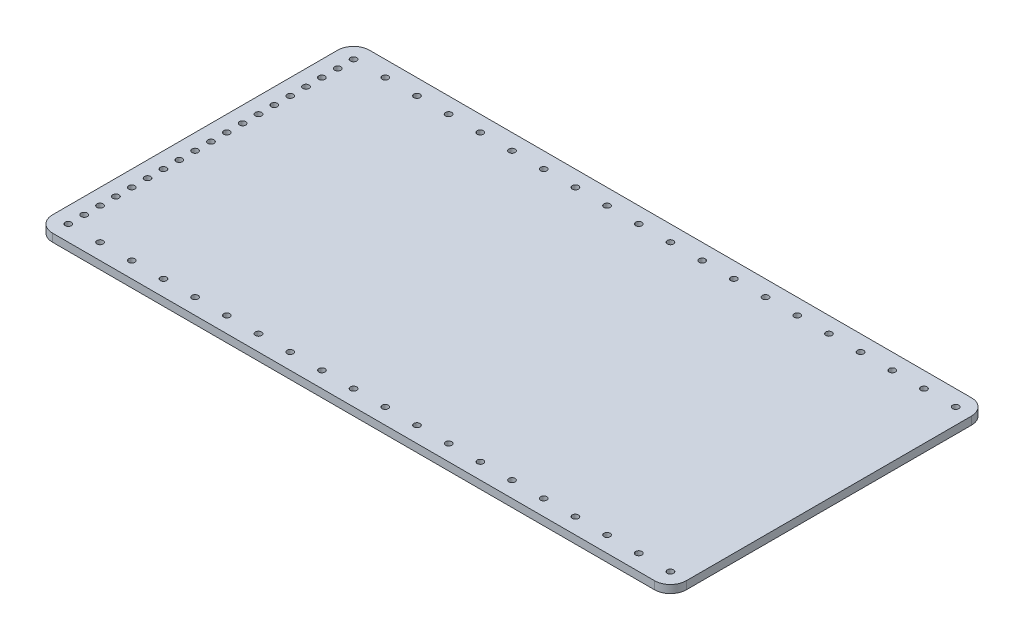
from build123d import *

# Parameters (mm, degrees)
SKETCH1_W           = 508
SKETCH1_H           = 254
BOSS_EXTRUDE1_DEPTH = 6.35
FILLET1_R           = 12.7
SKETCH3_R           = 2.4892
CUT_EXTRUDE2_DEPTH  = 568.996762755


with BuildPart() as part:
    # Sketch1 → Boss-Extrude1 (new body)
    with BuildSketch(Plane(origin=(0, 0, 0), x_dir=(1, 0, 0), z_dir=(0, 1, 0))):
        with Locations((254, 127)):
            Rectangle(SKETCH1_W, SKETCH1_H)
    extrude(amount=BOSS_EXTRUDE1_DEPTH)

    # Fillet1
    fillet1_edges = [part.edges().sort_by_distance(p)[0] for p in [
        (508, 3.175, -254),
        (508, 3.175, 0),
        (0, 3.175, 0),
        (0, 3.175, -254),
    ]]
    fillet(fillet1_edges, radius=FILLET1_R)

    # Sketch3 → Cut-Extrude2 (cut, through all)
    with BuildSketch(Plane(origin=(0, 6.35, 0), x_dir=(1, 0, 0), z_dir=(0, 1, 0))):
        with Locations((12.7, 203.2)):
            Circle(SKETCH3_R)
        with Locations((12.7, 215.9)):
            Circle(SKETCH3_R)
        with Locations((12.7, 228.6)):
            Circle(SKETCH3_R)
        with Locations((12.7, 241.3)):
            Circle(SKETCH3_R)
        with Locations((38.1, 241.3)):
            Circle(SKETCH3_R)
        with Locations((63.5, 241.3)):
            Circle(SKETCH3_R)
        with Locations((88.9, 241.3)):
            Circle(SKETCH3_R)
        with Locations((114.3, 241.3)):
            Circle(SKETCH3_R)
        with Locations((12.7, 12.7)):
            Circle(SKETCH3_R)
        with Locations((12.7, 25.4)):
            Circle(SKETCH3_R)
        with Locations((12.7, 38.1)):
            Circle(SKETCH3_R)
        with Locations((12.7, 50.8)):
            Circle(SKETCH3_R)
        with Locations((12.7, 63.5)):
            Circle(SKETCH3_R)
        with Locations((38.1, 12.7)):
            Circle(SKETCH3_R)
        with Locations((63.5, 12.7)):
            Circle(SKETCH3_R)
        with Locations((88.9, 12.7)):
            Circle(SKETCH3_R)
        with Locations((12.7, 101.6)):
            Circle(SKETCH3_R)
        with Locations((12.7, 114.3)):
            Circle(SKETCH3_R)
        with Locations((12.7, 127)):
            Circle(SKETCH3_R)
        with Locations((12.7, 139.7)):
            Circle(SKETCH3_R)
        with Locations((12.7, 165.1)):
            Circle(SKETCH3_R)
        with Locations((12.7, 152.4)):
            Circle(SKETCH3_R)
        with Locations((12.7, 177.8)):
            Circle(SKETCH3_R)
        with Locations((12.7, 190.5)):
            Circle(SKETCH3_R)
        with Locations((12.7, 88.9)):
            Circle(SKETCH3_R)
        with Locations((12.7, 76.2)):
            Circle(SKETCH3_R)
        with Locations((495.3, 12.7)):
            Circle(SKETCH3_R)
        with Locations((469.9, 12.7)):
            Circle(SKETCH3_R)
        with Locations((444.5, 12.7)):
            Circle(SKETCH3_R)
        with Locations((419.1, 12.7)):
            Circle(SKETCH3_R)
        with Locations((393.7, 12.7)):
            Circle(SKETCH3_R)
        with Locations((368.3, 12.7)):
            Circle(SKETCH3_R)
        with Locations((342.9, 12.7)):
            Circle(SKETCH3_R)
        with Locations((317.5, 12.7)):
            Circle(SKETCH3_R)
        with Locations((292.1, 12.7)):
            Circle(SKETCH3_R)
        with Locations((266.7, 12.7)):
            Circle(SKETCH3_R)
        with Locations((241.3, 12.7)):
            Circle(SKETCH3_R)
        with Locations((215.9, 12.7)):
            Circle(SKETCH3_R)
        with Locations((114.3, 12.7)):
            Circle(SKETCH3_R)
        with Locations((139.7, 12.7)):
            Circle(SKETCH3_R)
        with Locations((165.1, 12.7)):
            Circle(SKETCH3_R)
        with Locations((190.5, 12.7)):
            Circle(SKETCH3_R)
        with Locations((139.7, 241.3)):
            Circle(SKETCH3_R)
        with Locations((165.1, 241.3)):
            Circle(SKETCH3_R)
        with Locations((190.5, 241.3)):
            Circle(SKETCH3_R)
        with Locations((215.9, 241.3)):
            Circle(SKETCH3_R)
        with Locations((241.3, 241.3)):
            Circle(SKETCH3_R)
        with Locations((266.7, 241.3)):
            Circle(SKETCH3_R)
        with Locations((292.1, 241.3)):
            Circle(SKETCH3_R)
        with Locations((317.5, 241.3)):
            Circle(SKETCH3_R)
        with Locations((342.9, 241.3)):
            Circle(SKETCH3_R)
        with Locations((368.3, 241.3)):
            Circle(SKETCH3_R)
        with Locations((393.7, 241.3)):
            Circle(SKETCH3_R)
        with Locations((419.1, 241.3)):
            Circle(SKETCH3_R)
        with Locations((444.5, 241.3)):
            Circle(SKETCH3_R)
        with Locations((469.9, 241.3)):
            Circle(SKETCH3_R)
        with Locations((495.3, 241.3)):
            Circle(SKETCH3_R)
    extrude(amount=-CUT_EXTRUDE2_DEPTH, mode=Mode.SUBTRACT)


solid = part.part
